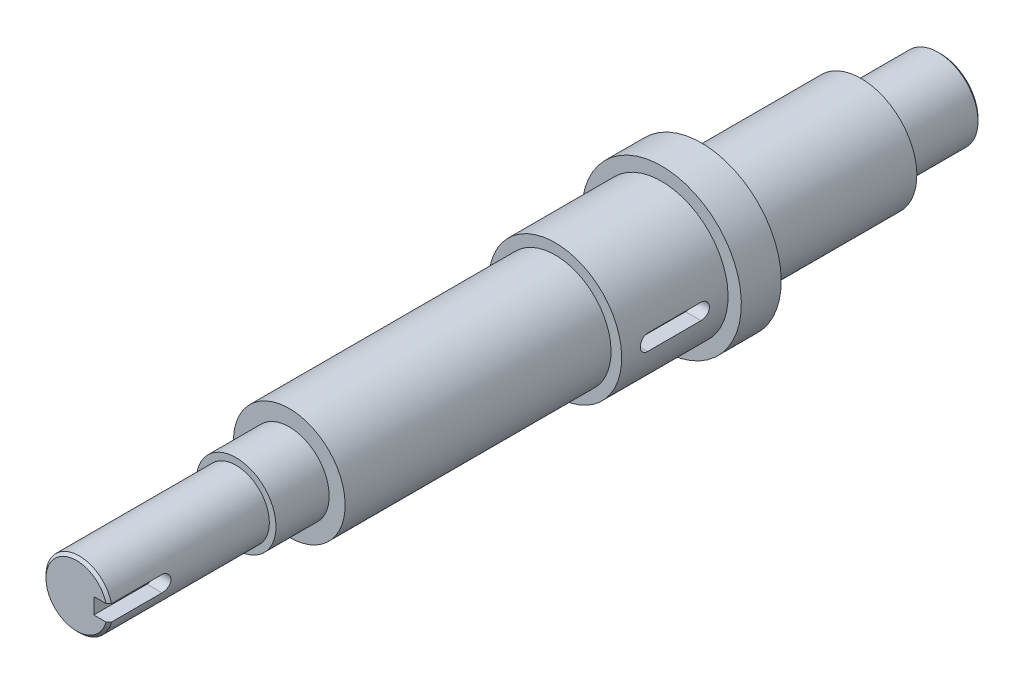
from build123d import *

# Parameters (mm, degrees)
M8X1_0_TAPPED_HOLE1_D     = 7
M8X1_0_TAPPED_HOLE1_DEPTH = 19
M8X1_0_TAPPED_HOLE1_TIP   = 2.103012167
CUT_EXTRUDE3_DEPTH        = 6
CUT_EXTRUDE4_DEPTH        = 6
CHAMFER1_SIZE             = 1


with BuildPart() as part:
    # Sketch2 → Revolve1 (revolve)
    with BuildSketch(Plane(origin=(0, 0, 0), x_dir=(0, 0, -1), z_dir=(1, 0, 0))):
        Polygon((-225, 12.5), (-225, 0), (100, 0), (100, 15), (70, 15), (70, 21), (10, 21), (10, 30), (-5, 30), (-5, 25), (-45, 25), (-45, 21), (-145, 21), (-145, 15), (-165, 15), (-165, 12.5), align=None)
    revolve(axis=Axis((0, 0, 225), (0, 0, -1)))

    # M8x1.0 Tapped Hole1
    with Locations(Plane(origin=(0, 0, -100), x_dir=(0, -1, 0), z_dir=(0, 0, -1))):
        with Locations((0, 0)):
            Hole(M8X1_0_TAPPED_HOLE1_D / 2, depth=M8X1_0_TAPPED_HOLE1_DEPTH)
            with Locations((0, 0, -(M8X1_0_TAPPED_HOLE1_DEPTH + M8X1_0_TAPPED_HOLE1_TIP / 2))):  # 118° drill point
                Cone(0, M8X1_0_TAPPED_HOLE1_D / 2, M8X1_0_TAPPED_HOLE1_TIP, mode=Mode.SUBTRACT)

    # Sketch4 → Cut-Extrude3 (cut)
    with BuildSketch(Plane(origin=(12.5, 0, 0), x_dir=(0, 0, -1), z_dir=(1, 0, 0))):
        with BuildLine():
            Line((-205, 3), (-225, 3))
            Line((-225, 3), (-225, -3))
            Line((-225, -3), (-205, -3))
            ThreePointArc((-205, -3), (-202, 0), (-205, 3))
        make_face()
    extrude(amount=-CUT_EXTRUDE3_DEPTH, mode=Mode.SUBTRACT)

    # Sketch5 → Cut-Extrude4 (cut)
    with BuildSketch(Plane(origin=(25, 0, 0), x_dir=(0, 0, -1), z_dir=(1, 0, 0))):
        with BuildLine():
            Line((-35, 3), (-15, 3))
            ThreePointArc((-15, 3), (-12, 0), (-15, -3))
            Line((-15, -3), (-35, -3))
            ThreePointArc((-35, -3), (-38, 0), (-35, 3))
        make_face()
    extrude(amount=-CUT_EXTRUDE4_DEPTH, mode=Mode.SUBTRACT)

    # Chamfer1
    chamfer1_edges = [part.edges().sort_by_distance(p)[0] for p in [
        (-9.842509843, -7.705517504, 225),
        (0, -15, -100),
    ]]
    chamfer(chamfer1_edges, length=CHAMFER1_SIZE)


solid = part.part
